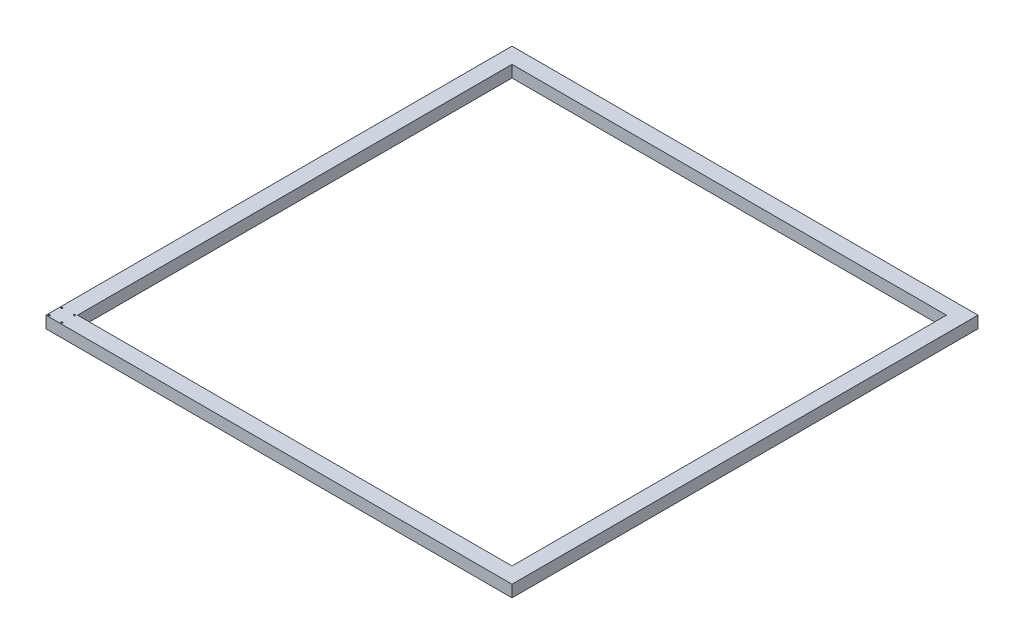
from build123d import *

# Parameters (mm, degrees)
ESBO_O1_W                = 5900
ESBO_O1_H                = 5900
ESBO_O1_W_2              = 5500
ESBO_O1_H_2              = 5500
RESSALTO_EXTRUS_O1_DEPTH = 150
ESBO_O6_R                = 10
CORTE_EXTRUS_O3_DEPTH    = 4175.625731727


with BuildPart() as part:
    # Esboço1 → Ressalto-extrusão1 (new body)
    with BuildSketch(Plane(origin=(0, 0, 0), x_dir=(1, 0, 0), z_dir=(0, 1, 0))):
        Rectangle(ESBO_O1_W, ESBO_O1_H)
        Rectangle(ESBO_O1_W_2, ESBO_O1_H_2, mode=Mode.SUBTRACT)
    extrude(amount=RESSALTO_EXTRUS_O1_DEPTH)

    # Esboço6 → Corte-extrusão3 (cut, through all)
    with BuildSketch(Plane(origin=(0, 150, 0), x_dir=(1, 0, 0), z_dir=(0, 1, 0))):
        with Locations((-2770, -2770)):
            Circle(ESBO_O6_R)
        with Locations((-2770, -2930)):
            Circle(ESBO_O6_R)
        with Locations((-2930, -2930)):
            Circle(ESBO_O6_R)
        with Locations((-2930, -2770)):
            Circle(ESBO_O6_R)
    extrude(amount=-CORTE_EXTRUS_O3_DEPTH, mode=Mode.SUBTRACT)


solid = part.part
